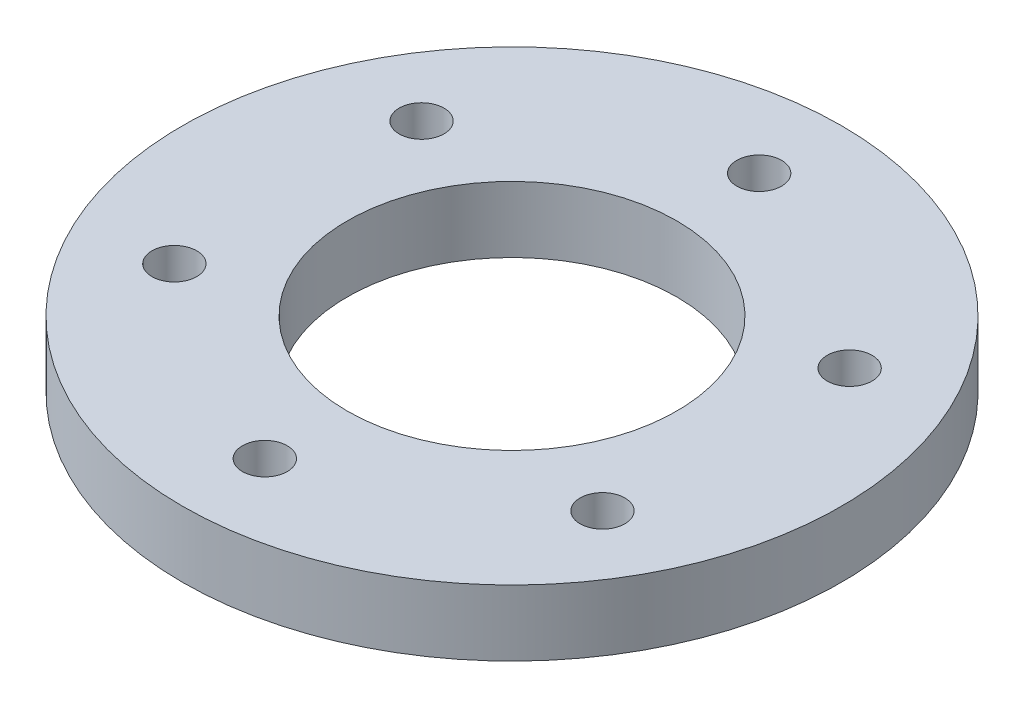
from build123d import *

# Parameters (mm, degrees)
SKETCH1_R           = 31.75
SKETCH1_R_2         = 2.159
SKETCH1_R_3         = 15.875
BOSS_EXTRUDE2_DEPTH = 6.35


with BuildPart() as part:
    # Sketch1 → Boss-Extrude2 (new body)
    with BuildSketch(Plane(origin=(0, 0, 0), x_dir=(1, 0, 0), z_dir=(0, 1, 0))):
        Circle(SKETCH1_R)
        with Locations((-20.622229928, -11.90625)):
            Circle(SKETCH1_R_2, mode=Mode.SUBTRACT)
        with Locations((0, -23.8125)):
            Circle(SKETCH1_R_2, mode=Mode.SUBTRACT)
        with Locations((20.622229928, -11.90625)):
            Circle(SKETCH1_R_2, mode=Mode.SUBTRACT)
        with Locations((-20.622229928, 11.90625)):
            Circle(SKETCH1_R_2, mode=Mode.SUBTRACT)
        Circle(SKETCH1_R_3, mode=Mode.SUBTRACT)
        with Locations((20.622229928, 11.90625)):
            Circle(SKETCH1_R_2, mode=Mode.SUBTRACT)
        with Locations((0, 23.8125)):
            Circle(SKETCH1_R_2, mode=Mode.SUBTRACT)
    extrude(amount=BOSS_EXTRUDE2_DEPTH)


solid = part.part
